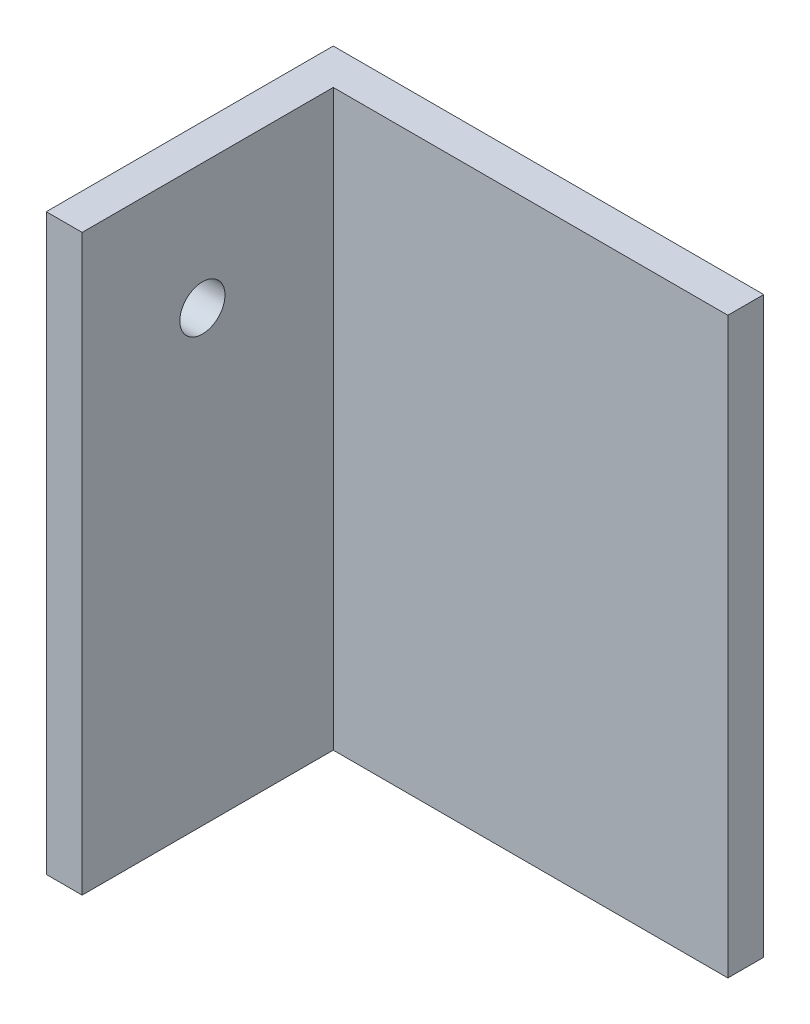
from build123d import *

# Parameters (mm, degrees)
BOSS_EXTRUDE1_DEPTH = 25.4
SKETCH2_R           = 2
CUT_EXTRUDE1_DEPTH  = 48.519048812


with BuildPart() as part:
    # Sketch1 → Boss-Extrude1 (new, symmetric)
    with BuildSketch(Plane(origin=(0, 0, 0), x_dir=(1, 0, 0), z_dir=(0, 1, 0))):
        Polygon((-19.05, -12.7), (-15.875, -12.7), (-15.875, 9.525), (19.05, 9.525), (19.05, 12.7), (-19.05, 12.7), align=None)
    extrude(amount=BOSS_EXTRUDE1_DEPTH, both=True)

    # Sketch2 → Cut-Extrude1 (cut, through all)
    with BuildSketch(Plane.ZY.offset(19.05)):
        with Locations((2.055, 14.2875)):
            Circle(SKETCH2_R)
    extrude(amount=-CUT_EXTRUDE1_DEPTH, mode=Mode.SUBTRACT)


solid = part.part
